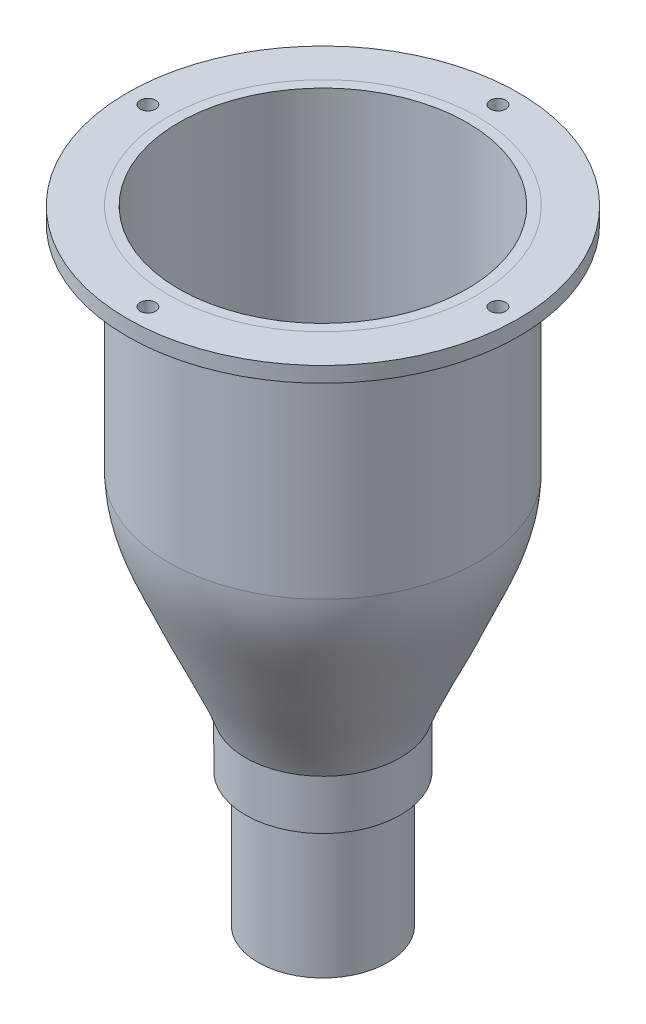
from build123d import *

# Parameters (mm, degrees)
SKETCH1_R           = 12.6
SKETCH1_R_2         = 11.1
BOSS_EXTRUDE1_DEPTH = 26
SKETCH2_R           = 30
SKETCH2_R_2         = 28
BOSS_EXTRUDE2_DEPTH = 45
SKETCH7_R           = 38
SKETCH7_R_2         = 30
BOSS_EXTRUDE3_DEPTH = 3
BOSS_EXTRUDE4_REACH = 111.147
SKETCH8_R           = 15.011589035
SKETCH8_R_2         = 12.6
CIRPATTERN1_COUNT   = 4


with BuildPart() as part:
    # Sketch1 → Boss-Extrude1 (new body)
    with BuildSketch(Plane(origin=(0, 0, 0), x_dir=(1, 0, 0), z_dir=(0, 1, 0))):
        Circle(SKETCH1_R)
        Circle(SKETCH1_R_2, mode=Mode.SUBTRACT)
    extrude(amount=-BOSS_EXTRUDE1_DEPTH)



with BuildPart() as body_2:
    # Sketch2 → Boss-Extrude2 (new body)
    with BuildSketch(Plane(origin=(0, 50, 0), x_dir=(1, 0, 0), z_dir=(0, 1, 0))):
        Circle(SKETCH2_R)
        Circle(SKETCH2_R_2, mode=Mode.SUBTRACT)
    extrude(amount=BOSS_EXTRUDE2_DEPTH)


with BuildPart() as part_1:
    add(part.part)

    add(body_2.part)  # Revolve2 merges body 2
    # Sketch6 → Revolve2 (revolve)
    with BuildSketch(Plane(origin=(0, 0, 0), x_dir=(0, 0, -1), z_dir=(1, 0, 0))):
        with BuildLine():
            Line((11.1, 0), (12.6, 0))
            add(Edge.make_bspline(
                [(12.6, 0), (14.219035257, 10.406719414), (19.217856603, 18.862718749), (26.118422644, 35.475812234), (29.68641801, 42.333036244), (30, 50)],
                knots=[0, 0, 0, 0, 0.476692395, 0.576692395, 1, 1, 1, 1], degree=3))
            Line((30, 50), (28, 50))
            add(Edge.make_bspline(
                [(11.1, 0), (11.515632478, 8.462663343), (16.287334783, 17.420081245), (23.903302421, 35.028645214), (26.560149287, 41.703867791), (28, 50)],
                knots=[0, 0, 0, 0, 0.530323892, 0.630323892, 1, 1, 1, 1], degree=3))
        make_face()
    revolve(axis=Axis((0, 0, 0), (0, 1, 0)))

    # Sketch8 → Boss-Extrude4 (add, up to next)
    with BuildSketch(Plane(origin=(0, 0, 0), x_dir=(1, 0, 0), z_dir=(0, 1, 0)), mode=Mode.PRIVATE) as boss_extrude4_sk1:
        Circle(SKETCH8_R)
        Circle(SKETCH8_R_2, mode=Mode.SUBTRACT)
    boss_extrude4_tool1 = extrude(boss_extrude4_sk1.sketch, amount=BOSS_EXTRUDE4_REACH, mode=Mode.PRIVATE) - part_1.part
    add(boss_extrude4_tool1.solids().sort_by_distance((-14.586997, 0, 0))[0])


with BuildPart() as body_2_2:
    # Sketch7 → Boss-Extrude3 (new body)
    with BuildSketch(Plane(origin=(0, 95, 0), x_dir=(1, 0, 0), z_dir=(0, 1, 0))):
        Circle(SKETCH7_R)
        Circle(SKETCH7_R_2, mode=Mode.SUBTRACT)
    extrude(amount=-BOSS_EXTRUDE3_DEPTH)

    # Sketch10 → Ø3.0 mm Dowel Holes1 (revolve, cut)
    with BuildSketch(Plane(origin=(0, 95, -34), x_dir=(0, 0, 1), z_dir=(1, 0, 0))):
        Polygon((0, 0), (0, 13.401290929), (1.5, 12.5), (1.5, 0), align=None)
    f_3_0_mm_dowel_holes1 = revolve(axis=Axis((0, 101.35, -34), (0, -1, 0)), mode=Mode.SUBTRACT)

    # CirPattern1: Ø3.0 mm Dowel Holes1 ×4 about axis
    cirpattern1_axis = Axis((0, 95, 0), (0, -1, 0))
    for i in range(1, CIRPATTERN1_COUNT):
        add(f_3_0_mm_dowel_holes1.rotate(cirpattern1_axis, i * 360 / CIRPATTERN1_COUNT), mode=Mode.SUBTRACT)


solid = Compound([part_1.part, body_2_2.part])
